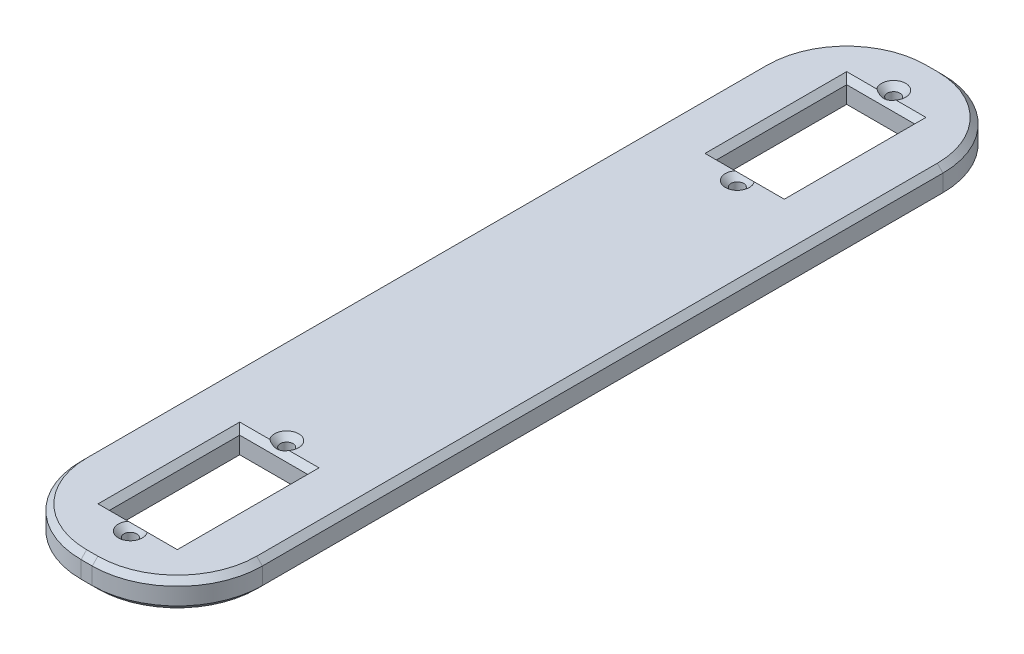
from build123d import *

# Parameters (mm, degrees)
SKETCH3_W           = 31.98
SKETCH3_H           = 150
SKETCH3_R           = 1.125
SKETCH3_W_2         = 11.98
SKETCH3_H_2         = 22.98
BOSS_EXTRUDE1_DEPTH = 5
FILLET1_R           = 15
CHAMFER1_SIZE       = 1


with BuildPart() as part:
    # Sketch3 → Boss-Extrude1 (new body)
    with BuildSketch(Plane(origin=(0, 0, 0), x_dir=(1, 0, 0), z_dir=(0, 1, 0))):
        Rectangle(SKETCH3_W, SKETCH3_H)
        with Locations(Location((0, 67.29, 0), (0, 0, 270))):
            Circle(SKETCH3_R, mode=Mode.SUBTRACT)
        with Locations(Location((0, 39.73, 0), (0, 0, 270))):
            Circle(SKETCH3_R, mode=Mode.SUBTRACT)
        with Locations(Location((0, -67.29, 0), (0, 0, 270))):
            Circle(SKETCH3_R, mode=Mode.SUBTRACT)
        with Locations(Location((0, -39.73, 0), (0, 0, 270))):
            Circle(SKETCH3_R, mode=Mode.SUBTRACT)
        with Locations((0, 53.51)):
            Rectangle(SKETCH3_W_2, SKETCH3_H_2, mode=Mode.SUBTRACT)
        with Locations((0, -53.51)):
            Rectangle(SKETCH3_W_2, SKETCH3_H_2, mode=Mode.SUBTRACT)
    extrude(amount=BOSS_EXTRUDE1_DEPTH)

    # Fillet1
    fillet1_edges = [part.edges().sort_by_distance(p)[0] for p in [
        (-15.99, 2.5, -75),
        (15.99, 2.5, -75),
        (15.99, 2.5, 75),
        (-15.99, 2.5, 75),
    ]]
    fillet(fillet1_edges, radius=FILLET1_R)

    # Chamfer1
    # the kernel refuses this chamfer: 1 mm, written as the material it takes off along each edge
    with BuildSketch(Plane(origin=(0, 0, 67.29), x_dir=(0, 0, 1), z_dir=(-1, 0, 0))) as chamfer1_piece_1:
        Polygon((1.125 + CHAMFER1_SIZE, 0), (1.125, CHAMFER1_SIZE), (1.125, 0), align=None)
    revolve(axis=Axis((0, 0, 67.29), (0, 1, 0)), mode=Mode.SUBTRACT)
    with BuildSketch(Plane(origin=(5.99, 0, 65), x_dir=(1.1857664299965085e-15, -0.027495876610586483, 0.9996219169112968), z_dir=(-1, 0, 0)), Plane(origin=(-5.99, 0, 42.02), x_dir=(0, -0.027495876610586292, -0.9996219169112968), z_dir=(1, 0, 0)), Plane(origin=(-5.99, 5, -42.02), x_dir=(0, 0.027495876610586414, 0.9996219169112968), z_dir=(1, 0, 0)), Plane(origin=(5.99, 5, -65), x_dir=(1.1857664299965085e-15, 0.027495876610586605, -0.9996219169112968), z_dir=(-1, 0, 0))) as chamfer1_piece_2:
        Polygon((CHAMFER1_SIZE * 0.999621916911, CHAMFER1_SIZE * 0.0274958766106), (-CHAMFER1_SIZE * 0.0274958766106, CHAMFER1_SIZE * 0.999621916911), (0, 0), align=None)
    extrude(amount=11.98, mode=Mode.SUBTRACT)
    with BuildSketch(Plane(origin=(5.99, 0, 42.02), x_dir=(0.9996219169112968, -0.027495876610586365, 0), z_dir=(0, 0, 1)), Plane(origin=(-5.99, 0, 65), x_dir=(-0.9996219169112968, -0.027495876610586365, 0), z_dir=(0, 0, -1)), Plane(origin=(5.99, 5, -42.02), x_dir=(0.9996219169112968, 0.027495876610586487, 0), z_dir=(0, 0, -1)), Plane(origin=(-5.99, 5, -65), x_dir=(-0.9996219169112968, 0.027495876610586487, 0), z_dir=(0, 0, 1))) as chamfer1_piece_3:
        Polygon((CHAMFER1_SIZE * 0.999621916911, CHAMFER1_SIZE * 0.0274958766106), (-CHAMFER1_SIZE * 0.0274958766106, CHAMFER1_SIZE * 0.999621916911), (0, 0), align=None)
    extrude(amount=22.98, mode=Mode.SUBTRACT)
    with BuildSketch(Plane(origin=(0, 0, 39.73), x_dir=(0, 0, 1), z_dir=(-1, 0, 0))) as chamfer1_piece_4:
        Polygon((1.125 + CHAMFER1_SIZE, 0), (1.125, CHAMFER1_SIZE), (1.125, 0), align=None)
    revolve(axis=Axis((0, 0, 39.73), (0, 1, 0)), mode=Mode.SUBTRACT)
    with BuildSketch(Plane(origin=(0, 0, -39.73), x_dir=(0, 0, 1), z_dir=(-1, 0, 0))) as chamfer1_piece_5:
        Polygon((1.125 + CHAMFER1_SIZE, 0), (1.125, CHAMFER1_SIZE), (1.125, 0), align=None)
    revolve(axis=Axis((0, 0, -39.73), (0, 1, 0)), mode=Mode.SUBTRACT)
    with BuildSketch(Plane(origin=(0, 0, -67.29), x_dir=(0, 0, 1), z_dir=(-1, 0, 0))) as chamfer1_piece_6:
        Polygon((1.125 + CHAMFER1_SIZE, 0), (1.125, CHAMFER1_SIZE), (1.125, 0), align=None)
    revolve(axis=Axis((0, 0, -67.29), (0, 1, 0)), mode=Mode.SUBTRACT)
    with BuildSketch(Plane(origin=(5.99, 0, -65), x_dir=(1.1857664299965085e-15, -0.027495876610586483, -0.9996219169112968), z_dir=(-1, 0, 0)), Plane(origin=(-5.99, 0, -42.02), x_dir=(0, -0.027495876610586292, 0.9996219169112968), z_dir=(1, 0, 0)), Plane(origin=(-5.99, 5, 42.02), x_dir=(0, 0.027495876610586414, -0.9996219169112968), z_dir=(1, 0, 0)), Plane(origin=(5.99, 5, 65), x_dir=(1.1857664299965085e-15, 0.027495876610586605, 0.9996219169112968), z_dir=(-1, 0, 0))) as chamfer1_piece_7:
        Polygon((CHAMFER1_SIZE * 0.999621916911, -CHAMFER1_SIZE * 0.0274958766106), (-CHAMFER1_SIZE * 0.0274958766106, -CHAMFER1_SIZE * 0.999621916911), (0, 0), align=None)
    extrude(amount=11.98, mode=Mode.SUBTRACT)
    with BuildSketch(Plane(origin=(-5.99, 0, -65), x_dir=(-0.9996219169112968, -0.027495876610586365, 0), z_dir=(0, 0, 1)), Plane(origin=(5.99, 0, -42.02), x_dir=(0.9996219169112968, -0.027495876610586365, 0), z_dir=(0, 0, -1)), Plane(origin=(-5.99, 5, 65), x_dir=(-0.9996219169112968, 0.027495876610586487, 0), z_dir=(0, 0, -1)), Plane(origin=(5.99, 5, 42.02), x_dir=(0.9996219169112968, 0.027495876610586487, 0), z_dir=(0, 0, 1))) as chamfer1_piece_8:
        Polygon((CHAMFER1_SIZE * 0.999621916911, -CHAMFER1_SIZE * 0.0274958766106), (-CHAMFER1_SIZE * 0.0274958766106, -CHAMFER1_SIZE * 0.999621916911), (0, 0), align=None)
    extrude(amount=22.98, mode=Mode.SUBTRACT)
    with BuildSketch(Plane(origin=(-15.99, 0, 60), x_dir=(-0.027495876610587354, 0.9996219169112968, 0), z_dir=(0, 0, -1)), Plane(origin=(15.99, 5, -60), x_dir=(-0.9996219169112968, 0.02749587661058651, 0), z_dir=(0, 0, 1))) as chamfer1_piece_9:
        Polygon((CHAMFER1_SIZE * 0.999621916911, CHAMFER1_SIZE * 0.0274958766106), (-CHAMFER1_SIZE * 0.0274958766106, CHAMFER1_SIZE * 0.999621916911), (0, 0), align=None)
    extrude(amount=120, mode=Mode.SUBTRACT)
    with BuildSketch(Plane(origin=(-15.99, 5, 60), x_dir=(-0.02749587661058735, -0.9996219169112968, 0), z_dir=(0, 0, -1)), Plane(origin=(15.99, 0, -60), x_dir=(-0.9996219169112968, -0.02749587661058639, 0), z_dir=(0, 0, 1))) as chamfer1_piece_10:
        Polygon((CHAMFER1_SIZE * 0.999621916911, -CHAMFER1_SIZE * 0.0274958766106), (-CHAMFER1_SIZE * 0.0274958766106, -CHAMFER1_SIZE * 0.999621916911), (0, 0), align=None)
    extrude(amount=120, mode=Mode.SUBTRACT)
    with BuildSketch(Plane(origin=(0, 5, -67.29), x_dir=(0, 0, 1), z_dir=(-1, 0, 0))) as chamfer1_piece_11:
        Polygon((1.125 + CHAMFER1_SIZE, 0), (1.125, -CHAMFER1_SIZE), (1.125, 0), align=None)
    revolve(axis=Axis((0, 5, -67.29), (0, 1, 0)), mode=Mode.SUBTRACT)
    with BuildSketch(Plane(origin=(-0.99, 0, -75), x_dir=(0, -0.027495876610586483, 0.9996219169112968), z_dir=(1, 0, 0)), Plane(origin=(0.99, 0, 75), x_dir=(0, -0.027495876610586483, -0.9996219169112968), z_dir=(-1, 0, 0))) as chamfer1_piece_12:
        Polygon((CHAMFER1_SIZE * 0.999621916911, -CHAMFER1_SIZE * 0.0274958766106), (-CHAMFER1_SIZE * 0.0274958766106, -CHAMFER1_SIZE * 0.999621916911), (0, 0), align=None)
    extrude(amount=1.98, mode=Mode.SUBTRACT)
    with BuildSketch(Plane(origin=(0.99, 0, 60), x_dir=(1, 0, 0), z_dir=(0, 0, -1))) as chamfer1_piece_13:
        Polygon((15 - CHAMFER1_SIZE, 0), (15, -CHAMFER1_SIZE), (15, 0), align=None)
    revolve(axis=Axis((0.99, 0, 60), (0, -1, 0)), revolution_arc=90, mode=Mode.SUBTRACT)
    with BuildSketch(Plane(origin=(-0.99, 0, 60), x_dir=(-1, 0, 0), z_dir=(0, 0, -1))) as chamfer1_piece_14:
        Polygon((15 - CHAMFER1_SIZE, 0), (15, CHAMFER1_SIZE), (15, 0), align=None)
    revolve(axis=Axis((-0.99, 0, 60), (0, 1, 0)), revolution_arc=90, mode=Mode.SUBTRACT)
    with BuildSketch(Plane(origin=(0.99, 0, -60), x_dir=(0, 0, -1), z_dir=(-1, 0, 0))) as chamfer1_piece_15:
        Polygon((15 - CHAMFER1_SIZE, 0), (15, -CHAMFER1_SIZE), (15, 0), align=None)
    revolve(axis=Axis((0.99, 0, -60), (0, -1, 0)), revolution_arc=90, mode=Mode.SUBTRACT)
    with BuildSketch(Plane(origin=(0, 5, -39.73), x_dir=(0, 0, 1), z_dir=(-1, 0, 0))) as chamfer1_piece_16:
        Polygon((1.125 + CHAMFER1_SIZE, 0), (1.125, -CHAMFER1_SIZE), (1.125, 0), align=None)
    revolve(axis=Axis((0, 5, -39.73), (0, 1, 0)), mode=Mode.SUBTRACT)
    with BuildSketch(Plane(origin=(-0.99, 0, -60), x_dir=(-1, 0, 0), z_dir=(0, 0, 1))) as chamfer1_piece_17:
        Polygon((15 - CHAMFER1_SIZE, 0), (15, -CHAMFER1_SIZE), (15, 0), align=None)
    revolve(axis=Axis((-0.99, 0, -60), (0, -1, 0)), revolution_arc=90, mode=Mode.SUBTRACT)
    with BuildSketch(Plane(origin=(-0.99, 5, -75), x_dir=(0, 0.027495876610586605, 0.9996219169112968), z_dir=(1, 0, 0)), Plane(origin=(0.99, 5, 75), x_dir=(0, 0.027495876610586605, -0.9996219169112968), z_dir=(-1, 0, 0))) as chamfer1_piece_18:
        Polygon((CHAMFER1_SIZE * 0.999621916911, CHAMFER1_SIZE * 0.0274958766106), (-CHAMFER1_SIZE * 0.0274958766106, CHAMFER1_SIZE * 0.999621916911), (0, 0), align=None)
    extrude(amount=1.98, mode=Mode.SUBTRACT)
    with BuildSketch(Plane(origin=(0.99, 5, 60), x_dir=(1, 0, 0), z_dir=(0, 0, -1))) as chamfer1_piece_19:
        Polygon((15 - CHAMFER1_SIZE, 0), (15, CHAMFER1_SIZE), (15, 0), align=None)
    revolve(axis=Axis((0.99, 5, 60), (0, -1, 0)), revolution_arc=90, mode=Mode.SUBTRACT)
    with BuildSketch(Plane(origin=(-0.99, 5, 60), x_dir=(-1, 0, 0), z_dir=(0, 0, -1))) as chamfer1_piece_20:
        Polygon((15, -CHAMFER1_SIZE), (15 - CHAMFER1_SIZE, 0), (15, 0), align=None)
    revolve(axis=Axis((-0.99, 5, 60), (0, 1, 0)), revolution_arc=90, mode=Mode.SUBTRACT)
    with BuildSketch(Plane(origin=(0, 5, 39.73), x_dir=(0, 0, 1), z_dir=(-1, 0, 0))) as chamfer1_piece_21:
        Polygon((1.125 + CHAMFER1_SIZE, 0), (1.125, -CHAMFER1_SIZE), (1.125, 0), align=None)
    revolve(axis=Axis((0, 5, 39.73), (0, 1, 0)), mode=Mode.SUBTRACT)
    with BuildSketch(Plane(origin=(0.99, 5, -60), x_dir=(0, 0, -1), z_dir=(-1, 0, 0))) as chamfer1_piece_22:
        Polygon((15 - CHAMFER1_SIZE, 0), (15, CHAMFER1_SIZE), (15, 0), align=None)
    revolve(axis=Axis((0.99, 5, -60), (0, -1, 0)), revolution_arc=90, mode=Mode.SUBTRACT)
    with BuildSketch(Plane(origin=(-0.99, 5, -60), x_dir=(-1, 0, 0), z_dir=(0, 0, 1))) as chamfer1_piece_23:
        Polygon((15, CHAMFER1_SIZE), (15 - CHAMFER1_SIZE, 0), (15, 0), align=None)
    revolve(axis=Axis((-0.99, 5, -60), (0, -1, 0)), revolution_arc=90, mode=Mode.SUBTRACT)
    with BuildSketch(Plane(origin=(0, 5, 67.29), x_dir=(0, 0, 1), z_dir=(-1, 0, 0))) as chamfer1_piece_24:
        Polygon((1.125 + CHAMFER1_SIZE, 0), (1.125, -CHAMFER1_SIZE), (1.125, 0), align=None)
    revolve(axis=Axis((0, 5, 67.29), (0, 1, 0)), mode=Mode.SUBTRACT)
    with BuildSketch(Plane(origin=(8.561682988, 0, 65), x_dir=(1.1857664299965085e-15, -0.027495876610586483, 0.9996219169112968), z_dir=(-1, 0, 0))) as chamfer1_piece_25a_section:
        Polygon((CHAMFER1_SIZE * 0.999621916911, CHAMFER1_SIZE * 0.0274958766106), (-CHAMFER1_SIZE * 0.0274958766106, CHAMFER1_SIZE * 0.999621916911), (0, 0), align=None)
    chamfer1_piece_25a = extrude(amount=14.551682988, mode=Mode.PRIVATE)
    chamfer1_piece_25a = split(chamfer1_piece_25a, bisect_by=Plane(origin=(5.99, 0.329793627, 65.329793627), z_dir=(1, 0, 0)), keep=Keep.TOP, mode=Mode.PRIVATE)
    with BuildSketch(Plane(origin=(5.99, 0, 42.02), x_dir=(0.9996219169112968, -0.027495876610586365, 0), z_dir=(0, 0, 1))) as chamfer1_piece_25b_section:
        Polygon((CHAMFER1_SIZE * 0.999621916911, CHAMFER1_SIZE * 0.0274958766106), (-CHAMFER1_SIZE * 0.0274958766106, CHAMFER1_SIZE * 0.999621916911), (0, 0), align=None)
    chamfer1_piece_25b = extrude(amount=25.551682988, mode=Mode.PRIVATE)
    chamfer1_piece_25b = split(chamfer1_piece_25b, bisect_by=Plane(origin=(6.319793627, 0.329793627, 65), z_dir=(0, 0, 1)), keep=Keep.TOP, mode=Mode.PRIVATE)
    chamfer1_piece_25 = chamfer1_piece_25a & chamfer1_piece_25b
    add(chamfer1_piece_25, mode=Mode.SUBTRACT)
    with BuildSketch(Plane(origin=(-5.99, 0, 67.571682988), x_dir=(-0.9996219169112968, -0.027495876610586365, 0), z_dir=(0, 0, -1))) as chamfer1_piece_26a_section:
        Polygon((CHAMFER1_SIZE * 0.999621916911, CHAMFER1_SIZE * 0.0274958766106), (-CHAMFER1_SIZE * 0.0274958766106, CHAMFER1_SIZE * 0.999621916911), (0, 0), align=None)
    chamfer1_piece_26a = extrude(amount=25.551682988, mode=Mode.PRIVATE)
    chamfer1_piece_26a = split(chamfer1_piece_26a, bisect_by=Plane(origin=(-6.319793627, 0.329793627, 65), z_dir=(0, 0, 1)), keep=Keep.TOP, mode=Mode.PRIVATE)
    with BuildSketch(Plane(origin=(5.99, 0, 65), x_dir=(1.1857664299965085e-15, -0.027495876610586483, 0.9996219169112968), z_dir=(-1, 0, 0))) as chamfer1_piece_26b_section:
        Polygon((CHAMFER1_SIZE * 0.999621916911, CHAMFER1_SIZE * 0.0274958766106), (-CHAMFER1_SIZE * 0.0274958766106, CHAMFER1_SIZE * 0.999621916911), (0, 0), align=None)
    chamfer1_piece_26b = extrude(amount=14.551682988, mode=Mode.PRIVATE)
    chamfer1_piece_26b = split(chamfer1_piece_26b, bisect_by=Plane(origin=(-5.99, 0.329793627, 65.329793627), z_dir=(-1, 0, 0)), keep=Keep.TOP, mode=Mode.PRIVATE)
    chamfer1_piece_26 = chamfer1_piece_26a & chamfer1_piece_26b
    add(chamfer1_piece_26, mode=Mode.SUBTRACT)
    with BuildSketch(Plane(origin=(-5.99, 0, 42.02), x_dir=(0, -0.027495876610586292, -0.9996219169112968), z_dir=(1, 0, 0))) as chamfer1_piece_27a_section:
        Polygon((CHAMFER1_SIZE * 0.999621916911, CHAMFER1_SIZE * 0.0274958766106), (-CHAMFER1_SIZE * 0.0274958766106, CHAMFER1_SIZE * 0.999621916911), (0, 0), align=None)
    chamfer1_piece_27a = extrude(amount=14.551682988, mode=Mode.PRIVATE)
    chamfer1_piece_27a = split(chamfer1_piece_27a, bisect_by=Plane(origin=(5.99, 0.329793627, 41.690206373), z_dir=(1, 0, 0)), keep=Keep.TOP, mode=Mode.PRIVATE)
    with BuildSketch(Plane(origin=(5.99, 0, 39.448317012), x_dir=(0.9996219169112968, -0.027495876610586365, 0), z_dir=(0, 0, 1))) as chamfer1_piece_27b_section:
        Polygon((CHAMFER1_SIZE * 0.999621916911, CHAMFER1_SIZE * 0.0274958766106), (-CHAMFER1_SIZE * 0.0274958766106, CHAMFER1_SIZE * 0.999621916911), (0, 0), align=None)
    chamfer1_piece_27b = extrude(amount=25.551682988, mode=Mode.PRIVATE)
    chamfer1_piece_27b = split(chamfer1_piece_27b, bisect_by=Plane(origin=(6.319793627, 0.329793627, 42.02), z_dir=(0, 0, -1)), keep=Keep.TOP, mode=Mode.PRIVATE)
    chamfer1_piece_27 = chamfer1_piece_27a & chamfer1_piece_27b
    add(chamfer1_piece_27, mode=Mode.SUBTRACT)
    with BuildSketch(Plane(origin=(-8.561682988, 0, 42.02), x_dir=(0, -0.027495876610586292, -0.9996219169112968), z_dir=(1, 0, 0))) as chamfer1_piece_28a_section:
        Polygon((CHAMFER1_SIZE * 0.999621916911, CHAMFER1_SIZE * 0.0274958766106), (-CHAMFER1_SIZE * 0.0274958766106, CHAMFER1_SIZE * 0.999621916911), (0, 0), align=None)
    chamfer1_piece_28a = extrude(amount=14.551682988, mode=Mode.PRIVATE)
    chamfer1_piece_28a = split(chamfer1_piece_28a, bisect_by=Plane(origin=(-5.99, 0.329793627, 41.690206373), z_dir=(-1, 0, 0)), keep=Keep.TOP, mode=Mode.PRIVATE)
    with BuildSketch(Plane(origin=(-5.99, 0, 65), x_dir=(-0.9996219169112968, -0.027495876610586365, 0), z_dir=(0, 0, -1))) as chamfer1_piece_28b_section:
        Polygon((CHAMFER1_SIZE * 0.999621916911, CHAMFER1_SIZE * 0.0274958766106), (-CHAMFER1_SIZE * 0.0274958766106, CHAMFER1_SIZE * 0.999621916911), (0, 0), align=None)
    chamfer1_piece_28b = extrude(amount=25.551682988, mode=Mode.PRIVATE)
    chamfer1_piece_28b = split(chamfer1_piece_28b, bisect_by=Plane(origin=(-6.319793627, 0.329793627, 42.02), z_dir=(0, 0, -1)), keep=Keep.TOP, mode=Mode.PRIVATE)
    chamfer1_piece_28 = chamfer1_piece_28a & chamfer1_piece_28b
    add(chamfer1_piece_28, mode=Mode.SUBTRACT)
    with BuildSketch(Plane(origin=(5.99, 0, -42.02), x_dir=(0.9996219169112968, -0.027495876610586365, 0), z_dir=(0, 0, -1))) as chamfer1_piece_29a_section:
        Polygon((CHAMFER1_SIZE * 0.999621916911, -CHAMFER1_SIZE * 0.0274958766106), (-CHAMFER1_SIZE * 0.0274958766106, -CHAMFER1_SIZE * 0.999621916911), (0, 0), align=None)
    chamfer1_piece_29a = extrude(amount=25.551682988, mode=Mode.PRIVATE)
    chamfer1_piece_29a = split(chamfer1_piece_29a, bisect_by=Plane(origin=(6.319793627, 0.329793627, -65), z_dir=(0, 0, -1)), keep=Keep.TOP, mode=Mode.PRIVATE)
    with BuildSketch(Plane(origin=(8.561682988, 0, -65), x_dir=(1.1857664299965085e-15, -0.027495876610586483, -0.9996219169112968), z_dir=(-1, 0, 0))) as chamfer1_piece_29b_section:
        Polygon((CHAMFER1_SIZE * 0.999621916911, -CHAMFER1_SIZE * 0.0274958766106), (-CHAMFER1_SIZE * 0.0274958766106, -CHAMFER1_SIZE * 0.999621916911), (0, 0), align=None)
    chamfer1_piece_29b = extrude(amount=14.551682988, mode=Mode.PRIVATE)
    chamfer1_piece_29b = split(chamfer1_piece_29b, bisect_by=Plane(origin=(5.99, 0.329793627, -65.329793627), z_dir=(1, 0, 0)), keep=Keep.TOP, mode=Mode.PRIVATE)
    chamfer1_piece_29 = chamfer1_piece_29a & chamfer1_piece_29b
    add(chamfer1_piece_29, mode=Mode.SUBTRACT)
    with BuildSketch(Plane(origin=(5.99, 0, -65), x_dir=(1.1857664299965085e-15, -0.027495876610586483, -0.9996219169112968), z_dir=(-1, 0, 0))) as chamfer1_piece_30a_section:
        Polygon((CHAMFER1_SIZE * 0.999621916911, -CHAMFER1_SIZE * 0.0274958766106), (-CHAMFER1_SIZE * 0.0274958766106, -CHAMFER1_SIZE * 0.999621916911), (0, 0), align=None)
    chamfer1_piece_30a = extrude(amount=14.551682988, mode=Mode.PRIVATE)
    chamfer1_piece_30a = split(chamfer1_piece_30a, bisect_by=Plane(origin=(-5.99, 0.329793627, -65.329793627), z_dir=(-1, 0, 0)), keep=Keep.TOP, mode=Mode.PRIVATE)
    with BuildSketch(Plane(origin=(-5.99, 0, -67.571682988), x_dir=(-0.9996219169112968, -0.027495876610586365, 0), z_dir=(0, 0, 1))) as chamfer1_piece_30b_section:
        Polygon((CHAMFER1_SIZE * 0.999621916911, -CHAMFER1_SIZE * 0.0274958766106), (-CHAMFER1_SIZE * 0.0274958766106, -CHAMFER1_SIZE * 0.999621916911), (0, 0), align=None)
    chamfer1_piece_30b = extrude(amount=25.551682988, mode=Mode.PRIVATE)
    chamfer1_piece_30b = split(chamfer1_piece_30b, bisect_by=Plane(origin=(-6.319793627, 0.329793627, -65), z_dir=(0, 0, -1)), keep=Keep.TOP, mode=Mode.PRIVATE)
    chamfer1_piece_30 = chamfer1_piece_30a & chamfer1_piece_30b
    add(chamfer1_piece_30, mode=Mode.SUBTRACT)
    with BuildSketch(Plane(origin=(-8.561682988, 0, -42.02), x_dir=(0, -0.027495876610586292, 0.9996219169112968), z_dir=(1, 0, 0))) as chamfer1_piece_31a_section:
        Polygon((CHAMFER1_SIZE * 0.999621916911, -CHAMFER1_SIZE * 0.0274958766106), (-CHAMFER1_SIZE * 0.0274958766106, -CHAMFER1_SIZE * 0.999621916911), (0, 0), align=None)
    chamfer1_piece_31a = extrude(amount=14.551682988, mode=Mode.PRIVATE)
    chamfer1_piece_31a = split(chamfer1_piece_31a, bisect_by=Plane(origin=(-5.99, 0.329793627, -41.690206373), z_dir=(-1, 0, 0)), keep=Keep.TOP, mode=Mode.PRIVATE)
    with BuildSketch(Plane(origin=(-5.99, 0, -65), x_dir=(-0.9996219169112968, -0.027495876610586365, 0), z_dir=(0, 0, 1))) as chamfer1_piece_31b_section:
        Polygon((CHAMFER1_SIZE * 0.999621916911, -CHAMFER1_SIZE * 0.0274958766106), (-CHAMFER1_SIZE * 0.0274958766106, -CHAMFER1_SIZE * 0.999621916911), (0, 0), align=None)
    chamfer1_piece_31b = extrude(amount=25.551682988, mode=Mode.PRIVATE)
    chamfer1_piece_31b = split(chamfer1_piece_31b, bisect_by=Plane(origin=(-6.319793627, 0.329793627, -42.02), z_dir=(0, 0, 1)), keep=Keep.TOP, mode=Mode.PRIVATE)
    chamfer1_piece_31 = chamfer1_piece_31a & chamfer1_piece_31b
    add(chamfer1_piece_31, mode=Mode.SUBTRACT)
    with BuildSketch(Plane(origin=(-5.99, 0, -42.02), x_dir=(0, -0.027495876610586292, 0.9996219169112968), z_dir=(1, 0, 0))) as chamfer1_piece_32a_section:
        Polygon((CHAMFER1_SIZE * 0.999621916911, -CHAMFER1_SIZE * 0.0274958766106), (-CHAMFER1_SIZE * 0.0274958766106, -CHAMFER1_SIZE * 0.999621916911), (0, 0), align=None)
    chamfer1_piece_32a = extrude(amount=14.551682988, mode=Mode.PRIVATE)
    chamfer1_piece_32a = split(chamfer1_piece_32a, bisect_by=Plane(origin=(5.99, 0.329793627, -41.690206373), z_dir=(1, 0, 0)), keep=Keep.TOP, mode=Mode.PRIVATE)
    with BuildSketch(Plane(origin=(5.99, 0, -39.448317012), x_dir=(0.9996219169112968, -0.027495876610586365, 0), z_dir=(0, 0, -1))) as chamfer1_piece_32b_section:
        Polygon((CHAMFER1_SIZE * 0.999621916911, -CHAMFER1_SIZE * 0.0274958766106), (-CHAMFER1_SIZE * 0.0274958766106, -CHAMFER1_SIZE * 0.999621916911), (0, 0), align=None)
    chamfer1_piece_32b = extrude(amount=25.551682988, mode=Mode.PRIVATE)
    chamfer1_piece_32b = split(chamfer1_piece_32b, bisect_by=Plane(origin=(6.319793627, 0.329793627, -42.02), z_dir=(0, 0, 1)), keep=Keep.TOP, mode=Mode.PRIVATE)
    chamfer1_piece_32 = chamfer1_piece_32a & chamfer1_piece_32b
    add(chamfer1_piece_32, mode=Mode.SUBTRACT)
    with BuildSketch(Plane(origin=(-5.99, 5, -42.02), x_dir=(0, 0.027495876610586414, 0.9996219169112968), z_dir=(1, 0, 0))) as chamfer1_piece_33a_section:
        Polygon((CHAMFER1_SIZE * 0.999621916911, CHAMFER1_SIZE * 0.0274958766106), (-CHAMFER1_SIZE * 0.0274958766106, CHAMFER1_SIZE * 0.999621916911), (0, 0), align=None)
    chamfer1_piece_33a = extrude(amount=14.551682988, mode=Mode.PRIVATE)
    chamfer1_piece_33a = split(chamfer1_piece_33a, bisect_by=Plane(origin=(5.99, 4.670206373, -41.690206373), z_dir=(1, 0, 0)), keep=Keep.TOP, mode=Mode.PRIVATE)
    with BuildSketch(Plane(origin=(5.99, 5, -39.448317012), x_dir=(0.9996219169112968, 0.027495876610586487, 0), z_dir=(0, 0, -1))) as chamfer1_piece_33b_section:
        Polygon((CHAMFER1_SIZE * 0.999621916911, CHAMFER1_SIZE * 0.0274958766106), (-CHAMFER1_SIZE * 0.0274958766106, CHAMFER1_SIZE * 0.999621916911), (0, 0), align=None)
    chamfer1_piece_33b = extrude(amount=25.551682988, mode=Mode.PRIVATE)
    chamfer1_piece_33b = split(chamfer1_piece_33b, bisect_by=Plane(origin=(6.319793627, 4.670206373, -42.02), z_dir=(0, 0, 1)), keep=Keep.TOP, mode=Mode.PRIVATE)
    chamfer1_piece_33 = chamfer1_piece_33a & chamfer1_piece_33b
    add(chamfer1_piece_33, mode=Mode.SUBTRACT)
    with BuildSketch(Plane(origin=(5.99, 5, -42.02), x_dir=(0.9996219169112968, 0.027495876610586487, 0), z_dir=(0, 0, -1))) as chamfer1_piece_34a_section:
        Polygon((CHAMFER1_SIZE * 0.999621916911, CHAMFER1_SIZE * 0.0274958766106), (-CHAMFER1_SIZE * 0.0274958766106, CHAMFER1_SIZE * 0.999621916911), (0, 0), align=None)
    chamfer1_piece_34a = extrude(amount=25.551682988, mode=Mode.PRIVATE)
    chamfer1_piece_34a = split(chamfer1_piece_34a, bisect_by=Plane(origin=(6.319793627, 4.670206373, -65), z_dir=(0, 0, -1)), keep=Keep.TOP, mode=Mode.PRIVATE)
    with BuildSketch(Plane(origin=(8.561682988, 5, -65), x_dir=(1.1857664299965085e-15, 0.027495876610586605, -0.9996219169112968), z_dir=(-1, 0, 0))) as chamfer1_piece_34b_section:
        Polygon((CHAMFER1_SIZE * 0.999621916911, CHAMFER1_SIZE * 0.0274958766106), (-CHAMFER1_SIZE * 0.0274958766106, CHAMFER1_SIZE * 0.999621916911), (0, 0), align=None)
    chamfer1_piece_34b = extrude(amount=14.551682988, mode=Mode.PRIVATE)
    chamfer1_piece_34b = split(chamfer1_piece_34b, bisect_by=Plane(origin=(5.99, 4.670206373, -65.329793627), z_dir=(1, 0, 0)), keep=Keep.TOP, mode=Mode.PRIVATE)
    chamfer1_piece_34 = chamfer1_piece_34a & chamfer1_piece_34b
    add(chamfer1_piece_34, mode=Mode.SUBTRACT)
    with BuildSketch(Plane(origin=(-8.561682988, 5, -42.02), x_dir=(0, 0.027495876610586414, 0.9996219169112968), z_dir=(1, 0, 0))) as chamfer1_piece_35a_section:
        Polygon((CHAMFER1_SIZE * 0.999621916911, CHAMFER1_SIZE * 0.0274958766106), (-CHAMFER1_SIZE * 0.0274958766106, CHAMFER1_SIZE * 0.999621916911), (0, 0), align=None)
    chamfer1_piece_35a = extrude(amount=14.551682988, mode=Mode.PRIVATE)
    chamfer1_piece_35a = split(chamfer1_piece_35a, bisect_by=Plane(origin=(-5.99, 4.670206373, -41.690206373), z_dir=(-1, 0, 0)), keep=Keep.TOP, mode=Mode.PRIVATE)
    with BuildSketch(Plane(origin=(-5.99, 5, -65), x_dir=(-0.9996219169112968, 0.027495876610586487, 0), z_dir=(0, 0, 1))) as chamfer1_piece_35b_section:
        Polygon((CHAMFER1_SIZE * 0.999621916911, CHAMFER1_SIZE * 0.0274958766106), (-CHAMFER1_SIZE * 0.0274958766106, CHAMFER1_SIZE * 0.999621916911), (0, 0), align=None)
    chamfer1_piece_35b = extrude(amount=25.551682988, mode=Mode.PRIVATE)
    chamfer1_piece_35b = split(chamfer1_piece_35b, bisect_by=Plane(origin=(-6.319793627, 4.670206373, -42.02), z_dir=(0, 0, 1)), keep=Keep.TOP, mode=Mode.PRIVATE)
    chamfer1_piece_35 = chamfer1_piece_35a & chamfer1_piece_35b
    add(chamfer1_piece_35, mode=Mode.SUBTRACT)
    with BuildSketch(Plane(origin=(5.99, 5, -65), x_dir=(1.1857664299965085e-15, 0.027495876610586605, -0.9996219169112968), z_dir=(-1, 0, 0))) as chamfer1_piece_36a_section:
        Polygon((CHAMFER1_SIZE * 0.999621916911, CHAMFER1_SIZE * 0.0274958766106), (-CHAMFER1_SIZE * 0.0274958766106, CHAMFER1_SIZE * 0.999621916911), (0, 0), align=None)
    chamfer1_piece_36a = extrude(amount=14.551682988, mode=Mode.PRIVATE)
    chamfer1_piece_36a = split(chamfer1_piece_36a, bisect_by=Plane(origin=(-5.99, 4.670206373, -65.329793627), z_dir=(-1, 0, 0)), keep=Keep.TOP, mode=Mode.PRIVATE)
    with BuildSketch(Plane(origin=(-5.99, 5, -67.571682988), x_dir=(-0.9996219169112968, 0.027495876610586487, 0), z_dir=(0, 0, 1))) as chamfer1_piece_36b_section:
        Polygon((CHAMFER1_SIZE * 0.999621916911, CHAMFER1_SIZE * 0.0274958766106), (-CHAMFER1_SIZE * 0.0274958766106, CHAMFER1_SIZE * 0.999621916911), (0, 0), align=None)
    chamfer1_piece_36b = extrude(amount=25.551682988, mode=Mode.PRIVATE)
    chamfer1_piece_36b = split(chamfer1_piece_36b, bisect_by=Plane(origin=(-6.319793627, 4.670206373, -65), z_dir=(0, 0, -1)), keep=Keep.TOP, mode=Mode.PRIVATE)
    chamfer1_piece_36 = chamfer1_piece_36a & chamfer1_piece_36b
    add(chamfer1_piece_36, mode=Mode.SUBTRACT)
    with BuildSketch(Plane(origin=(-5.99, 5, 67.571682988), x_dir=(-0.9996219169112968, 0.027495876610586487, 0), z_dir=(0, 0, -1))) as chamfer1_piece_37a_section:
        Polygon((CHAMFER1_SIZE * 0.999621916911, -CHAMFER1_SIZE * 0.0274958766106), (-CHAMFER1_SIZE * 0.0274958766106, -CHAMFER1_SIZE * 0.999621916911), (0, 0), align=None)
    chamfer1_piece_37a = extrude(amount=25.551682988, mode=Mode.PRIVATE)
    chamfer1_piece_37a = split(chamfer1_piece_37a, bisect_by=Plane(origin=(-6.319793627, 4.670206373, 65), z_dir=(0, 0, 1)), keep=Keep.TOP, mode=Mode.PRIVATE)
    with BuildSketch(Plane(origin=(5.99, 5, 65), x_dir=(1.1857664299965085e-15, 0.027495876610586605, 0.9996219169112968), z_dir=(-1, 0, 0))) as chamfer1_piece_37b_section:
        Polygon((CHAMFER1_SIZE * 0.999621916911, -CHAMFER1_SIZE * 0.0274958766106), (-CHAMFER1_SIZE * 0.0274958766106, -CHAMFER1_SIZE * 0.999621916911), (0, 0), align=None)
    chamfer1_piece_37b = extrude(amount=14.551682988, mode=Mode.PRIVATE)
    chamfer1_piece_37b = split(chamfer1_piece_37b, bisect_by=Plane(origin=(-5.99, 4.670206373, 65.329793627), z_dir=(-1, 0, 0)), keep=Keep.TOP, mode=Mode.PRIVATE)
    chamfer1_piece_37 = chamfer1_piece_37a & chamfer1_piece_37b
    add(chamfer1_piece_37, mode=Mode.SUBTRACT)
    with BuildSketch(Plane(origin=(-8.561682988, 5, 42.02), x_dir=(0, 0.027495876610586414, -0.9996219169112968), z_dir=(1, 0, 0))) as chamfer1_piece_38a_section:
        Polygon((CHAMFER1_SIZE * 0.999621916911, -CHAMFER1_SIZE * 0.0274958766106), (-CHAMFER1_SIZE * 0.0274958766106, -CHAMFER1_SIZE * 0.999621916911), (0, 0), align=None)
    chamfer1_piece_38a = extrude(amount=14.551682988, mode=Mode.PRIVATE)
    chamfer1_piece_38a = split(chamfer1_piece_38a, bisect_by=Plane(origin=(-5.99, 4.670206373, 41.690206373), z_dir=(-1, 0, 0)), keep=Keep.TOP, mode=Mode.PRIVATE)
    with BuildSketch(Plane(origin=(-5.99, 5, 65), x_dir=(-0.9996219169112968, 0.027495876610586487, 0), z_dir=(0, 0, -1))) as chamfer1_piece_38b_section:
        Polygon((CHAMFER1_SIZE * 0.999621916911, -CHAMFER1_SIZE * 0.0274958766106), (-CHAMFER1_SIZE * 0.0274958766106, -CHAMFER1_SIZE * 0.999621916911), (0, 0), align=None)
    chamfer1_piece_38b = extrude(amount=25.551682988, mode=Mode.PRIVATE)
    chamfer1_piece_38b = split(chamfer1_piece_38b, bisect_by=Plane(origin=(-6.319793627, 4.670206373, 42.02), z_dir=(0, 0, -1)), keep=Keep.TOP, mode=Mode.PRIVATE)
    chamfer1_piece_38 = chamfer1_piece_38a & chamfer1_piece_38b
    add(chamfer1_piece_38, mode=Mode.SUBTRACT)
    with BuildSketch(Plane(origin=(-5.99, 5, 42.02), x_dir=(0, 0.027495876610586414, -0.9996219169112968), z_dir=(1, 0, 0))) as chamfer1_piece_39a_section:
        Polygon((CHAMFER1_SIZE * 0.999621916911, -CHAMFER1_SIZE * 0.0274958766106), (-CHAMFER1_SIZE * 0.0274958766106, -CHAMFER1_SIZE * 0.999621916911), (0, 0), align=None)
    chamfer1_piece_39a = extrude(amount=14.551682988, mode=Mode.PRIVATE)
    chamfer1_piece_39a = split(chamfer1_piece_39a, bisect_by=Plane(origin=(5.99, 4.670206373, 41.690206373), z_dir=(1, 0, 0)), keep=Keep.TOP, mode=Mode.PRIVATE)
    with BuildSketch(Plane(origin=(5.99, 5, 39.448317012), x_dir=(0.9996219169112968, 0.027495876610586487, 0), z_dir=(0, 0, 1))) as chamfer1_piece_39b_section:
        Polygon((CHAMFER1_SIZE * 0.999621916911, -CHAMFER1_SIZE * 0.0274958766106), (-CHAMFER1_SIZE * 0.0274958766106, -CHAMFER1_SIZE * 0.999621916911), (0, 0), align=None)
    chamfer1_piece_39b = extrude(amount=25.551682988, mode=Mode.PRIVATE)
    chamfer1_piece_39b = split(chamfer1_piece_39b, bisect_by=Plane(origin=(6.319793627, 4.670206373, 42.02), z_dir=(0, 0, -1)), keep=Keep.TOP, mode=Mode.PRIVATE)
    chamfer1_piece_39 = chamfer1_piece_39a & chamfer1_piece_39b
    add(chamfer1_piece_39, mode=Mode.SUBTRACT)
    with BuildSketch(Plane(origin=(8.561682988, 5, 65), x_dir=(1.1857664299965085e-15, 0.027495876610586605, 0.9996219169112968), z_dir=(-1, 0, 0))) as chamfer1_piece_40a_section:
        Polygon((CHAMFER1_SIZE * 0.999621916911, -CHAMFER1_SIZE * 0.0274958766106), (-CHAMFER1_SIZE * 0.0274958766106, -CHAMFER1_SIZE * 0.999621916911), (0, 0), align=None)
    chamfer1_piece_40a = extrude(amount=14.551682988, mode=Mode.PRIVATE)
    chamfer1_piece_40a = split(chamfer1_piece_40a, bisect_by=Plane(origin=(5.99, 4.670206373, 65.329793627), z_dir=(1, 0, 0)), keep=Keep.TOP, mode=Mode.PRIVATE)
    with BuildSketch(Plane(origin=(5.99, 5, 42.02), x_dir=(0.9996219169112968, 0.027495876610586487, 0), z_dir=(0, 0, 1))) as chamfer1_piece_40b_section:
        Polygon((CHAMFER1_SIZE * 0.999621916911, -CHAMFER1_SIZE * 0.0274958766106), (-CHAMFER1_SIZE * 0.0274958766106, -CHAMFER1_SIZE * 0.999621916911), (0, 0), align=None)
    chamfer1_piece_40b = extrude(amount=25.551682988, mode=Mode.PRIVATE)
    chamfer1_piece_40b = split(chamfer1_piece_40b, bisect_by=Plane(origin=(6.319793627, 4.670206373, 65), z_dir=(0, 0, 1)), keep=Keep.TOP, mode=Mode.PRIVATE)
    chamfer1_piece_40 = chamfer1_piece_40a & chamfer1_piece_40b
    add(chamfer1_piece_40, mode=Mode.SUBTRACT)


solid = part.part
